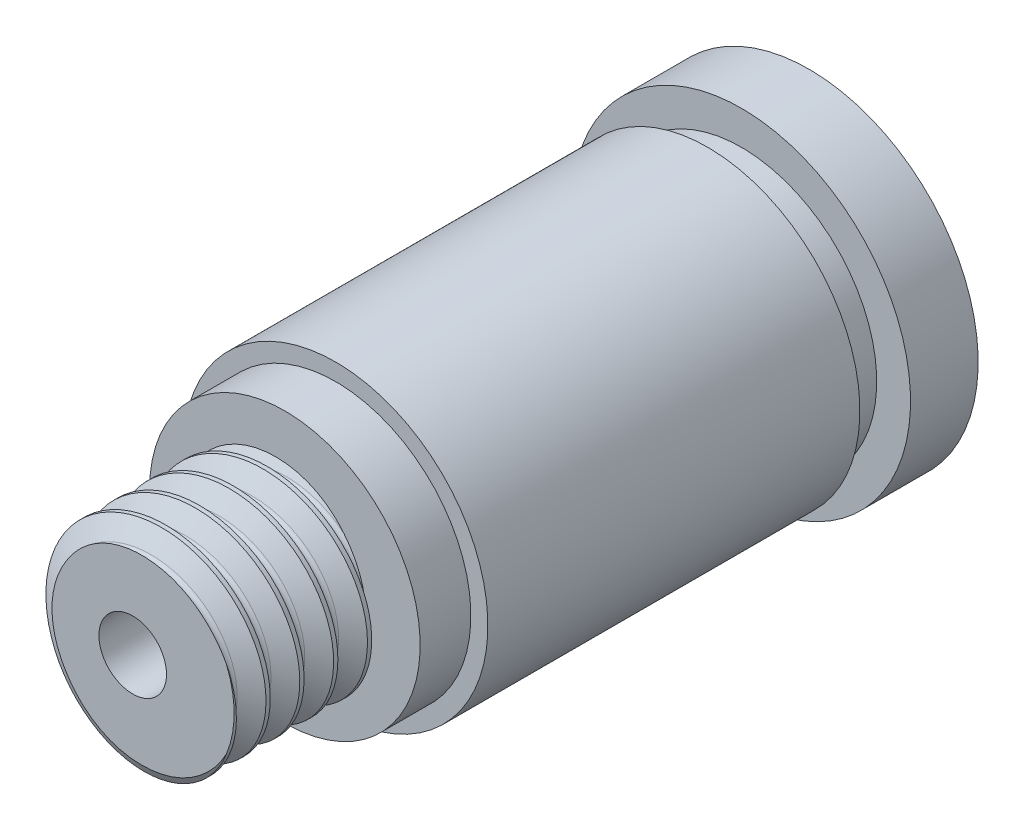
from build123d import *

# Parameters (mm, degrees)
SKETCH1_R           = 3
BOSS_EXTRUDE1_DEPTH = 4.5
CUT_SWEEP2_PITCH    = 1
SKETCH4_R           = 4
BOSS_EXTRUDE2_DEPTH = 1.5
SKETCH5_R           = 4.502612731
BOSS_EXTRUDE3_DEPTH = 11
SKETCH6_R           = 4
BOSS_EXTRUDE4_DEPTH = 1
SKETCH7_R           = 5
BOSS_EXTRUDE5_DEPTH = 2
SKETCH9_R           = 1
CUT_EXTRUDE1_DEPTH  = 51
SKETCH10_R          = 2
CUT_EXTRUDE2_DEPTH  = 10


with BuildPart() as part:
    # Sketch1 → Boss-Extrude1 (new body)
    with BuildSketch(Plane.XY):
        Circle(SKETCH1_R)
    extrude(amount=BOSS_EXTRUDE1_DEPTH)

    # Cut-Sweep2: arcs per turn and ends read off the stored shape
    # Cut-Sweep2: the profile of Sketch3 screwed along a right-hand helix through 7.25 turns, 8 arcs to a turn; built about Z, then put on its axis
    cut_sweep2_z = Axis((0, 0, 0), (0, 0, 1))
    cut_sweep2_corners = [(2.458771404, 0, -0.875292342), (3.022194267, 0, -0.55), (3.022194267, 0, -1.45), (2.458771404, 0, -1.124707658), (2.386771404, 0, -1)]
    with BuildLine(mode=Mode.PRIVATE) as cut_sweep2_profile:
        Line(cut_sweep2_corners[0], cut_sweep2_corners[1])
        Line(cut_sweep2_corners[1], cut_sweep2_corners[2])
        Line(cut_sweep2_corners[2], cut_sweep2_corners[3])
        ThreePointArc((2.458771404, 0, -1.124707658), (2.406063746, 0, -1.072), (2.386771404, 0, -1))
        ThreePointArc((2.386771404, 0, -1), (2.406063746, 0, -0.928), (2.458771404, 0, -0.875292342))
    cut_sweep2_cap = Face(cut_sweep2_profile.wire())
    cut_sweep2_arcs = [((2.458771404, 0, -1.124707658), (2.386771404, 0, -1.083138439), (2.386771404, 0, -1), (1, 0.8660254037844367, 1)), ((2.386771404, 0, -1), (2.386771404, 0, -0.916861561), (2.458771404, 0, -0.875292342), (1, 0.8660254037844367, 1))]  # start, shoulder, end, weights
    cut_sweep2_turn_angles = [0, 22.5, 45, 67.5, 90, 112.5, 135, 157.5, 180, 202.5, 225, 247.5, 270, 292.5, 315, 337.5, 360]
    cut_sweep2_turn_weights = [1, 0.9238795325112867, 1, 0.9238795325112867, 1, 0.9238795325112867, 1, 0.9238795325112867, 1, 0.9238795325112867, 1, 0.9238795325112867, 1, 0.9238795325112867, 1, 0.9238795325112867, 1]
    cut_sweep2_turn_rails = [Edge.make_bspline([Vector(p[0], p[1], 0).rotate(cut_sweep2_z, cut_sweep2_turn_angles[k]) / cut_sweep2_turn_weights[k] + Vector(0, 0, p[2] + CUT_SWEEP2_PITCH * cut_sweep2_turn_angles[k] / 360) for k in range(17)], [0, 0, 0, 1, 1, 2, 2, 3, 3, 4, 4, 5, 5, 6, 6, 7, 7, 8, 8, 8], 2, cut_sweep2_turn_weights) for p in cut_sweep2_corners]
    cut_sweep2_turn_sides = [*[Face.make_surface_from_curves(cut_sweep2_turn_rails[p[0]], cut_sweep2_turn_rails[p[1]]) for p in [(0, 1), (1, 2), (2, 3)]], *[Face.make_bezier_surface([[Vector(p[j][0], p[j][1], 0).rotate(cut_sweep2_z, cut_sweep2_turn_angles[2 * i + k]) / cut_sweep2_turn_weights[2 * i + k] + Vector(0, 0, p[j][2] + CUT_SWEEP2_PITCH * cut_sweep2_turn_angles[2 * i + k] / 360) for k in range(3)] for j in range(3)], [[p[3][j] * cut_sweep2_turn_weights[2 * i + k] for k in range(3)] for j in range(3)]) for p in cut_sweep2_arcs for i in range(8)]]
    cut_sweep2_last_angles = [2520, 2542.5, 2565, 2587.5, 2610]
    cut_sweep2_last_weights = [1, 0.9238795325112867, 1, 0.9238795325112867, 1]
    cut_sweep2_last_rails = [Edge.make_bspline([Vector(p[0], p[1], 0).rotate(cut_sweep2_z, cut_sweep2_last_angles[k]) / cut_sweep2_last_weights[k] + Vector(0, 0, p[2] + CUT_SWEEP2_PITCH * cut_sweep2_last_angles[k] / 360) for k in range(5)], [0, 0, 0, 1, 1, 2, 2, 2], 2, cut_sweep2_last_weights) for p in cut_sweep2_corners]
    cut_sweep2_last_sides = [*[Face.make_surface_from_curves(cut_sweep2_last_rails[p[0]], cut_sweep2_last_rails[p[1]]) for p in [(0, 1), (1, 2), (2, 3)]], *[Face.make_bezier_surface([[Vector(p[j][0], p[j][1], 0).rotate(cut_sweep2_z, cut_sweep2_last_angles[2 * i + k]) / cut_sweep2_last_weights[2 * i + k] + Vector(0, 0, p[j][2] + CUT_SWEEP2_PITCH * cut_sweep2_last_angles[2 * i + k] / 360) for k in range(3)] for j in range(3)], [[p[3][j] * cut_sweep2_last_weights[2 * i + k] for k in range(3)] for j in range(3)]) for p in cut_sweep2_arcs for i in range(2)]]
    cut_sweep2 = Plane(origin=(0, 0, 4.5), x_dir=(-1, 0, 0), z_dir=(0, 0, -1)) * Solid(Shell([*[p.moved(Location((0, 0, CUT_SWEEP2_PITCH * i))) for i in range(7) for p in cut_sweep2_turn_sides], *cut_sweep2_last_sides, cut_sweep2_cap, cut_sweep2_cap.rotate(cut_sweep2_z, 2610).moved(Location((0, 0, CUT_SWEEP2_PITCH * 2610 / 360)))]))
    add(cut_sweep2, mode=Mode.SUBTRACT)

    # Sketch4 → Boss-Extrude2 (add)
    with BuildSketch(Plane(origin=(0, 0, 0), x_dir=(-1, 0, 0), z_dir=(0, 0, -1))):
        Circle(SKETCH4_R)
    extrude(amount=BOSS_EXTRUDE2_DEPTH)

    # Sketch5 → Boss-Extrude3 (add)
    with BuildSketch(Plane(origin=(0, 0, -1.5), x_dir=(-1, 0, 0), z_dir=(0, 0, -1))):
        Circle(SKETCH5_R)
    extrude(amount=BOSS_EXTRUDE3_DEPTH)

    # Sketch6 → Boss-Extrude4 (add)
    with BuildSketch(Plane(origin=(0, 0, -12.5), x_dir=(-1, 0, 0), z_dir=(0, 0, -1))):
        Circle(SKETCH6_R)
    extrude(amount=BOSS_EXTRUDE4_DEPTH)

    # Sketch7 → Boss-Extrude5 (add)
    with BuildSketch(Plane(origin=(0, 0, -13.5), x_dir=(-1, 0, 0), z_dir=(0, 0, -1))):
        Circle(SKETCH7_R)
    extrude(amount=BOSS_EXTRUDE5_DEPTH)

    # Sketch9 → Cut-Extrude1 (cut)
    with BuildSketch(Plane.XY.offset(4.5)):
        Circle(SKETCH9_R)
    extrude(amount=-CUT_EXTRUDE1_DEPTH, mode=Mode.SUBTRACT)

    # Sketch10 → Cut-Extrude2 (cut)
    with BuildSketch(Plane(origin=(0, 0, -15.5), x_dir=(-1, 0, 0), z_dir=(0, 0, -1))):
        Circle(SKETCH10_R)
    extrude(amount=-CUT_EXTRUDE2_DEPTH, mode=Mode.SUBTRACT)


solid = part.part
